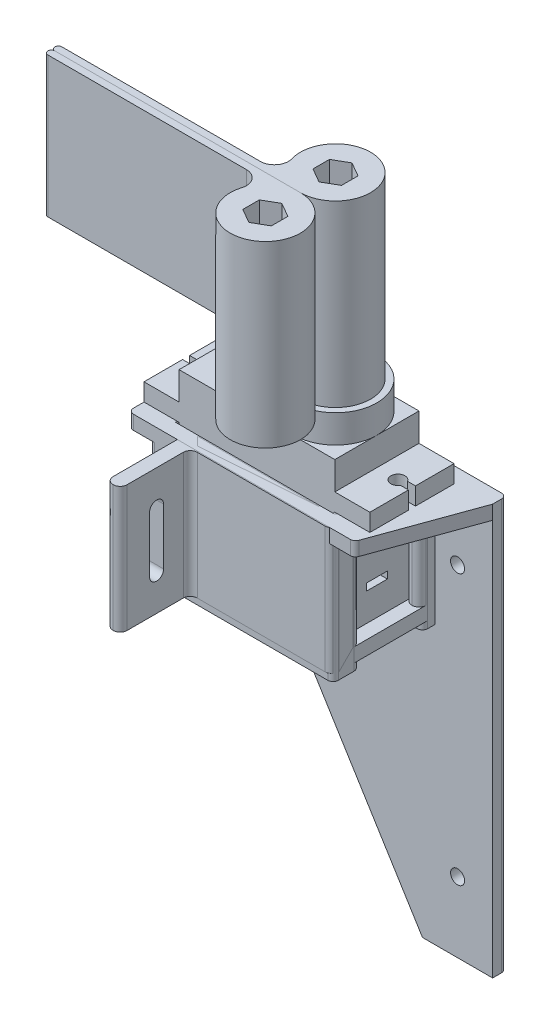
from build123d import *
from build123d.topology import SkipClean

# Parameters (mm, degrees)
SKETCH1_W                = 22.2
SKETCH1_H                = 12
BOSS_EXTRUDE1_DEPTH      = 22.5
SKETCH1_4_W              = 5
SKETCH1_4_H              = 12
BOSS_EXTRUDE9_DEPTH      = 18.5
SKETCH1_3_W              = 5
SKETCH1_3_H              = 12
CUT_EXTRUDE1_DEPTH       = 16
SKETCH3_R                = 2.5
BOSS_EXTRUDE10_DEPTH     = 4
SKETCH3_2_R              = 2.5
BOSS_EXTRUDE11_DEPTH     = 7
CUT_EXTRUDE2_DEPTH       = 2.5
SKETCH6_W                = 1.5
SKETCH6_H                = 1
CUT_EXTRUDE3_DEPTH       = 3
BOSS_EXTRUDE12_DEPTH     = 2
BOSS_EXTRUDE13_DEPTH     = 16
FILLET1_R                = 1
CUT_EXTRUDE4_DEPTH       = 4
SKETCH9_R                = 2.5
BOSS_EXTRUDE14_DEPTH     = 4
SKETCH9_3_R              = 0.6
BOSS_EXTRUDE15_DEPTH     = 1.5
BOSS_EXTRUDE16_START     = -2
BOSS_EXTRUDE16_OUTLINE_R = 2.5
BOSS_EXTRUDE16_DEPTH     = 2
CUT_EXTRUDE5_START       = -1
SKETCH9_5_R              = 2.5
CUT_EXTRUDE5_DEPTH       = 1
SKETCH10_R               = 5
SKETCH10_R_2             = 2.75
SKETCH10_R_3             = 2.5
BOSS_EXTRUDE17_DEPTH     = 22.5
SKETCH10_4_R             = 5
SKETCH10_4_R_2           = 2.75
BOSS_EXTRUDE18_DEPTH     = 3
FILLET2_R                = 2
CUT_EXTRUDE6_DEPTH       = 2.5
BOSS_EXTRUDE24_START     = -2
BOSS_EXTRUDE24_OUTLINE_R = 1
BOSS_EXTRUDE24_OUTLINE_W = 22.7
BOSS_EXTRUDE24_OUTLINE_H = 12.5
BOSS_EXTRUDE24_DEPTH     = 2
SKETCH18_W               = 1.75
SKETCH18_H               = 1.75
BOSS_EXTRUDE30_DEPTH     = 17
BOSS_EXTRUDE31_DEPTH     = 39.5
SKETCH20_R               = 1
CUT_EXTRUDE9_DEPTH       = 48.5
BOSS_EXTRUDE32_DEPTH     = 2
FILLET5_R                = 0.75


# Read off the part's stored shape, not the designer's step: Boss-Extrude16, Boss-Extrude24
# Some blends are built 0.0001 mm under size
with BuildPart() as part:
    # Sketch1 → Boss-Extrude1 (new body)
    with BuildSketch(Plane(origin=(0, 0, 0), x_dir=(1, 0, 0), z_dir=(0, 1, 0))):
        with Locations((11.1, 6)):
            Rectangle(SKETCH1_W, SKETCH1_H)
    extrude(amount=BOSS_EXTRUDE1_DEPTH)

    # Sketch1<4> → Boss-Extrude9 (add)
    with BuildSketch(Plane(origin=(0, 0, 0), x_dir=(1, 0, 0), z_dir=(0, 1, 0))):
        with Locations((-2.5, 6)):
            Rectangle(SKETCH1_4_W, SKETCH1_4_H)
        with Locations((24.7, 6)):
            Rectangle(SKETCH1_4_W, SKETCH1_4_H)
    extrude(amount=BOSS_EXTRUDE9_DEPTH)

    # Sketch1<3> → Cut-Extrude1 (cut)
    with BuildSketch(Plane(origin=(0, 0, 0), x_dir=(1, 0, 0), z_dir=(0, 1, 0))):
        with Locations((-2.5, 6)):
            Rectangle(SKETCH1_3_W, SKETCH1_3_H)
        with Locations((24.7, 6)):
            Rectangle(SKETCH1_3_W, SKETCH1_3_H)
    extrude(amount=CUT_EXTRUDE1_DEPTH, mode=Mode.SUBTRACT)

    # Sketch3 → Boss-Extrude10 (add)
    with BuildSketch(Plane(origin=(0, 22.5, 0), x_dir=(1, 0, 0), z_dir=(0, 1, 0))):
        with BuildLine():
            ThreePointArc((11.051851852, 3.304273564), (22.2, 6), (11.051851852, 8.695726436))
            ThreePointArc((11.051851852, 8.695726436), (8.2, 6), (11.051851852, 3.304273564))
        make_face()
        with Locations(Location((16.3, 6, 0), (0, 0, 270))):
            Circle(SKETCH3_R, mode=Mode.SUBTRACT)
    extrude(amount=BOSS_EXTRUDE10_DEPTH)

    # Sketch3<2> → Boss-Extrude11 (add)
    with BuildSketch(Plane(origin=(0, 22.5, 0), x_dir=(1, 0, 0), z_dir=(0, 1, 0))):
        with Locations(Location((16.3, 6, 0), (0, 0, 270))):
            Circle(SKETCH3_2_R)
    extrude(amount=BOSS_EXTRUDE11_DEPTH)

    # Sketch4 → Cut-Extrude2 (cut)
    with BuildSketch(Plane(origin=(0, 18.5, 0), x_dir=(1, 0, 0), z_dir=(0, 1, 0))):
        with BuildLine():
            ThreePointArc((-3.866025404, 5.5), (-2.741180955, 5.034074174), (-2, 6))
            Line((-2, 6), (-4, 6))
            ThreePointArc((-4, 6), (-3.965925826, 5.741180955), (-3.866025404, 5.5))
        make_face()
        with BuildLine():
            Line((-4, 6), (-2, 6))
            ThreePointArc((-2, 6), (-2.741180955, 6.965925826), (-3.866025404, 6.5))
            ThreePointArc((-3.866025404, 6.5), (-3.965925826, 6.258819045), (-4, 6))
        make_face()
        with BuildLine():
            ThreePointArc((-3.866025404, 5.5), (-3.965925826, 5.741180955), (-4, 6))
            Line((-4, 6), (-5, 6))
            Line((-5, 6), (-5, 5.5))
            Line((-5, 5.5), (-3.866025404, 5.5))
        make_face()
        with BuildLine():
            Line((-5, 6), (-4, 6))
            ThreePointArc((-4, 6), (-3.965925826, 6.258819045), (-3.866025404, 6.5))
            Line((-3.866025404, 6.5), (-5, 6.5))
            Line((-5, 6.5), (-5, 6))
        make_face()
        with BuildLine():
            Line((27.2, 6), (26.2, 6))
            ThreePointArc((26.2, 6), (26.165925826, 5.741180955), (26.066025404, 5.5))
            Line((26.066025404, 5.5), (27.2, 5.5))
            Line((27.2, 5.5), (27.2, 6))
        make_face()
        with BuildLine():
            ThreePointArc((26.066025404, 6.5), (26.165925826, 6.258819045), (26.2, 6))
            Line((26.2, 6), (27.2, 6))
            Line((27.2, 6), (27.2, 6.5))
            Line((27.2, 6.5), (26.066025404, 6.5))
        make_face()
        with BuildLine():
            ThreePointArc((26.066025404, 5.5), (26.165925826, 5.741180955), (26.2, 6))
            Line((26.2, 6), (24.2, 6))
            ThreePointArc((24.2, 6), (24.941180955, 5.034074174), (26.066025404, 5.5))
        make_face()
        with BuildLine():
            Line((24.2, 6), (26.2, 6))
            ThreePointArc((26.2, 6), (26.165925826, 6.258819045), (26.066025404, 6.5))
            ThreePointArc((26.066025404, 6.5), (24.941180955, 6.965925826), (24.2, 6))
        make_face()
    extrude(amount=-CUT_EXTRUDE2_DEPTH, mode=Mode.SUBTRACT)

    # Sketch6 → Cut-Extrude3 (cut)
    with BuildSketch(Plane(origin=(22.2, 0, 0), x_dir=(0, 0, -1), z_dir=(1, 0, 0))):
        with Locations((6.75, 4.5)):
            Rectangle(SKETCH6_W, SKETCH6_H)
        with Locations((5.25, 4.5)):
            Rectangle(SKETCH6_W, SKETCH6_H)
    extrude(amount=-CUT_EXTRUDE3_DEPTH, mode=Mode.SUBTRACT)


with BuildPart() as body_2:
    # Sketch7 → Boss-Extrude12 (new body)
    with BuildSketch(Plane.XZ):
        Polygon((24.2, 2.4), (4, 2.4), (4, 12.4), (2, 12.4), (2, 0.4), (22.2, 0.4), (22.2, 0), (2, 0), (2, -24), (4, -24), (4, -14), (24.2, -14), align=None)
    extrude(amount=BOSS_EXTRUDE12_DEPTH)

    # Sketch7<3> → Boss-Extrude13 (add)
    with BuildSketch(Plane.XZ):
        Polygon((22.2, -1.6), (24.2, -1.6), (24.2, 2.4), (4, 2.4), (4, 12.4), (2, 12.4), (2, 0.4), (22.2, 0.4), align=None)
        Polygon((24.2, -14), (24.2, -10), (22.2, -10), (22.2, -12), (2, -12), (2, -24), (4, -24), (4, -14), align=None)
    extrude(amount=-BOSS_EXTRUDE13_DEPTH)

    # Fillet1
    fillet1_edges = [body_2.edges().sort_by_distance(p)[0] for p in [
        (24.2, 8, -10),
        (22.2, 8, -10),
        (22.2, 8, -1.6),
        (24.2, 8, -1.6),
        (24.2, 7, -14),
        (24.2, 7, 2.4),
        (2, 7, -24),
        (4, 7, -24),
        (4, 7, -14),
        (2, 8, -12),
        (2, 7, 0.4),
        (2, 7, 12.4),
        (4, 7, 12.4),
        (4, 7, 2.4),
    ]]
    fillet(fillet1_edges, radius=FILLET1_R - 0.0001)  # a hair under: the kernel refuses the full size

    # Sketch8 → Cut-Extrude4 (cut)
    with BuildSketch(Plane.ZY.offset(-2)):
        with BuildLine():
            Line((-17.8, 11), (-17.8, 3))
            ThreePointArc((-17.8, 3), (-18.8, 2), (-19.8, 3))
            Line((-19.8, 3), (-19.8, 11))
            ThreePointArc((-19.8, 11), (-18.8, 12), (-17.8, 11))
        make_face()
        with BuildLine():
            Line((8.2, 11), (8.2, 3))
            ThreePointArc((8.2, 3), (7.2, 2), (6.2, 3))
            Line((6.2, 3), (6.2, 11))
            ThreePointArc((6.2, 11), (7.2, 12), (8.2, 11))
        make_face()
    extrude(amount=-CUT_EXTRUDE4_DEPTH, mode=Mode.SUBTRACT)


with BuildPart() as body_3:
    # Sketch9 → Boss-Extrude14 (new body)
    with BuildSketch(Plane(origin=(0, 29.5, 0), x_dir=(1, 0, 0), z_dir=(0, 1, 0))):
        with BuildLine():
            ThreePointArc((14.072894255, 3.3), (12.8, 6), (14.072894255, 8.7))
            ThreePointArc((14.072894255, 8.7), (19.8, 6), (14.072894255, 3.3))
        make_face()
        with Locations(Location((16.3, 6, 0), (0, 0, 270))):
            Circle(SKETCH9_R, mode=Mode.SUBTRACT)
    extrude(amount=-BOSS_EXTRUDE14_DEPTH)

    # Sketch9<3> → Boss-Extrude15 (add)
    with BuildSketch(Plane(origin=(0, 29.5, 0), x_dir=(1, 0, 0), z_dir=(0, 1, 0))):
        with BuildLine():
            Line((1.736176892, 4.003241552), (14.072894255, 3.3))
            ThreePointArc((14.072894255, 3.3), (12.8, 6), (14.072894255, 8.7))
            Line((14.072894255, 8.7), (1.736176892, 7.996758448))
            ThreePointArc((1.736176892, 7.996758448), (-0.15, 6), (1.736176892, 4.003241552))
        make_face()
        with Locations(Location((1.85, 6, 0), (0, 0, 270))):
            Circle(SKETCH9_3_R, mode=Mode.SUBTRACT)
        with Locations(Location((5.85, 6, 0), (0, 0, 270))):
            Circle(SKETCH9_3_R, mode=Mode.SUBTRACT)
        with Locations(Location((7.85, 6, 0), (0, 0, 270))):
            Circle(SKETCH9_3_R, mode=Mode.SUBTRACT)
        with Locations(Location((9.85, 6, 0), (0, 0, 270))):
            Circle(SKETCH9_3_R, mode=Mode.SUBTRACT)
        with Locations(Location((11.85, 6, 0), (0, 0, 270))):
            Circle(SKETCH9_3_R, mode=Mode.SUBTRACT)
        with Locations(Location((3.85, 6, 0), (0, 0, 270))):
            Circle(SKETCH9_3_R, mode=Mode.SUBTRACT)
    extrude(amount=-BOSS_EXTRUDE15_DEPTH)

    # Boss-Extrude16 outline → Boss-Extrude16 (add)
    with BuildSketch(Plane(origin=(0, 29.5, 0), x_dir=(1, 0, 0), z_dir=(0, 1, 0)).offset(BOSS_EXTRUDE16_START)):
        with Locations((16.3, 6)):
            Circle(BOSS_EXTRUDE16_OUTLINE_R)
    extrude(amount=BOSS_EXTRUDE16_DEPTH)

    # Sketch9<5> → Cut-Extrude5 (cut)
    with BuildSketch(Plane(origin=(0, 29.5, 0), x_dir=(1, 0, 0), z_dir=(0, 1, 0)).offset(CUT_EXTRUDE5_START)):
        with Locations(Location((16.3, 6, 0), (0, 0, 270))):
            Circle(SKETCH9_5_R)
    extrude(amount=CUT_EXTRUDE5_DEPTH, mode=Mode.SUBTRACT)


with BuildPart() as body_4:
    # Sketch10 → Boss-Extrude17 (new body)
    # profile 1 of 4: a face of its own
    with BuildSketch(Plane(origin=(0, 29.5, 0), x_dir=(1, 0, 0), z_dir=(0, 1, 0))):
        with Locations((16.3, 6)):
            Circle(SKETCH10_R)
        with Locations((16.3, 6)):
            Circle(SKETCH10_R_2, mode=Mode.SUBTRACT)
    # profile 2 of 4: a face of its own
    with BuildSketch(Plane(origin=(0, 29.5, 0), x_dir=(1, 0, 0), z_dir=(0, 1, 0))):
        with BuildLine():
            Line((-18.7, 1), (16.3, 1))
            ThreePointArc((16.3, 1), (14.71886117, 1.25658351), (13.3, 2))
            Line((13.3, 2), (-18.7, 2))
            ThreePointArc((-18.7, 2), (-19.2, 1.5), (-18.7, 1))
        make_face()
    # profile 3 of 4: a face of its own
    with BuildSketch(Plane(origin=(0, 29.5, 0), x_dir=(1, 0, 0), z_dir=(0, 1, 0))):
        with Locations((16.3, 6)):
            Circle(SKETCH10_R_2)
        with Locations(Location((16.3, 6, 0), (0, 0, 270))):
            Circle(SKETCH10_R_3, mode=Mode.SUBTRACT)
    # profile 4 of 4: a face of its own
    with BuildSketch(Plane(origin=(0, 29.5, 0), x_dir=(1, 0, 0), z_dir=(0, 1, 0))):
        with Locations(Location((16.3, 6, 0), (0, 0, 270))):
            Circle(SKETCH10_R_3)
        Polygon((16.3, 3.65), (18.335159699, 4.825), (18.335159699, 7.175), (16.3, 8.35), (14.264840301, 7.175), (14.264840301, 4.825), align=None, mode=Mode.SUBTRACT)
    extrude(amount=BOSS_EXTRUDE17_DEPTH)

    # Sketch10<4> → Boss-Extrude18 (add)
    with SkipClean():  # the faces are left unmerged after this step: merging them gives an invalid solid
        with BuildSketch(Plane(origin=(0, 29.5, 0), x_dir=(1, 0, 0), z_dir=(0, 1, 0))):
            with Locations(Location((16.3, 6, 0), (0, 0, 270))):
                Circle(SKETCH10_4_R)
            with Locations(Location((16.3, 6, 0), (0, 0, 270))):
                Circle(SKETCH10_4_R_2, mode=Mode.SUBTRACT)
        extrude(amount=-BOSS_EXTRUDE18_DEPTH)
    add(body_4.part.scale(1), mode=Mode.REPLACE)  # the faces are merged on a copy

    # Fillet2
    # the kernel refuses this fillet: 2 mm, written as the material it adds along each edge
    with BuildSketch(Plane(origin=(13.3, 29.5, -2), x_dir=(-0.5716565927510521, 0, -0.8204929859323954), z_dir=(0, 1, 0))) as fillet2_piece_1:
        with BuildLine():
            CenterArc((3.760805197, 1.899242132), FILLET2_R, 145.134174023, 106.601549599)
            Line((2.119819225, 3.042555317), (0, 0))
            ThreePointArc((0, 0), (1.567002165, 0.251894671), (3.134004331, 0))
        make_face()
    extrude(amount=22.5)

    # Sketch11 → Cut-Extrude6 (cut)
    with BuildSketch(Plane.XZ.offset(-29.5)):
        with BuildLine():
            Line((-18.7, -2), (9.591796068, -2))
            ThreePointArc((9.591796068, -2), (11.195363519, -2.804771391), (11.508425763, -4.571428571))
            ThreePointArc((11.508425763, -4.571428571), (13.311928477, -1.991081371), (16.3, -1))
            Line((16.3, -1), (-18.7, -1))
            ThreePointArc((-18.7, -1), (-19.2, -1.5), (-18.7, -2))
        make_face()
    extrude(amount=-CUT_EXTRUDE6_DEPTH, mode=Mode.SUBTRACT)


with BuildPart() as body_5:
    # Mirror2: mirrored copy
    add(body_4.part.mirror(Plane(origin=(0, 52, -1), x_dir=(1, 0, 0), z_dir=(0, 0, 1))))


with BuildPart() as body_6:
    # Boss-Extrude24 outline → Boss-Extrude24 (new body)
    with BuildSketch(Plane(origin=(0, 16, 0), x_dir=(1, 0, 0), z_dir=(0, 1, 0)).offset(BOSS_EXTRUDE24_START)):
        Polygon((32.45, 14.25), (-5, 14.25), (-5, -2.25), (27.2, -2.25), (32.45, 12.25), align=None)
        with Locations((-3, 6)):
            Circle(BOSS_EXTRUDE24_OUTLINE_R, mode=Mode.SUBTRACT)
        with Locations((11.1, 6)):
            Rectangle(BOSS_EXTRUDE24_OUTLINE_W, BOSS_EXTRUDE24_OUTLINE_H, mode=Mode.SUBTRACT)
        with Locations((25.2, 6)):
            Circle(BOSS_EXTRUDE24_OUTLINE_R, mode=Mode.SUBTRACT)
    extrude(amount=BOSS_EXTRUDE24_DEPTH)

    # Sketch18 → Boss-Extrude30 (add)
    with BuildSketch(Plane.XZ.offset(-14)):
        Polygon((24.2, 2.25), (-2, 2.25), (-2, -12.25), (-0.25, -12.25), (-0.25, 0.25), (22.45, 0.25), (22.45, -1.5), (24.2, -1.5), align=None)
        with Locations((23.325, -11.375)):
            Rectangle(SKETCH18_W, SKETCH18_H)
        Polygon((-0.25, -12.25), (-2, -12.25), (-2, -14.25), (32.45, -14.25), (32.45, -12.25), (24.2, -12.25), (22.45, -12.25), align=None)
    extrude(amount=BOSS_EXTRUDE30_DEPTH)

    # Sketch19 → Boss-Extrude31 (add)
    with BuildSketch(Plane.XZ.offset(3)):
        Polygon((22.45, -12.25), (22.45, -14.25), (32.45, -14.25), (32.45, -12.25), (24.2, -12.25), align=None)
    extrude(amount=BOSS_EXTRUDE31_DEPTH)

    # Sketch20 → Cut-Extrude9 (cut)
    with BuildSketch(Plane.XY.offset(-12.25)):
        with Locations((27.45, 6)):
            Circle(SKETCH20_R)
        with Locations((27.45, -32.5)):
            Circle(SKETCH20_R)
    extrude(amount=-CUT_EXTRUDE9_DEPTH, mode=Mode.SUBTRACT)

    # Sketch21 → Boss-Extrude32 (add)
    with BuildSketch(Plane.XY.offset(-12.25)):
        Polygon((22.45, -42.5), (-2, -3), (22.45, -3), align=None)
    extrude(amount=-BOSS_EXTRUDE32_DEPTH)

    # Fillet5
    fillet5_edges = [body_6.edges().sort_by_distance(p)[0] for p in [
        (-5, 15, 2.25),
        (27.2, 15, 2.25),
        (32.45, -13.25, -14.25),
        (-5, 15, -14.25),
        (-2, 5.5, 2.25),
        (-2, 5.5, -14.25),
        (24.2, 5.5, -10.5),
        (22.45, 5.5, -10.5),
        (22.45, 5.5, -1.5),
        (24.2, 5.5, -1.5),
        (24.2, 5.5, 2.25),
    ]]
    fillet(fillet5_edges, radius=FILLET5_R)


solid = Compound([part.part, body_2.part, body_3.part, body_4.part, body_5.part, body_6.part])
